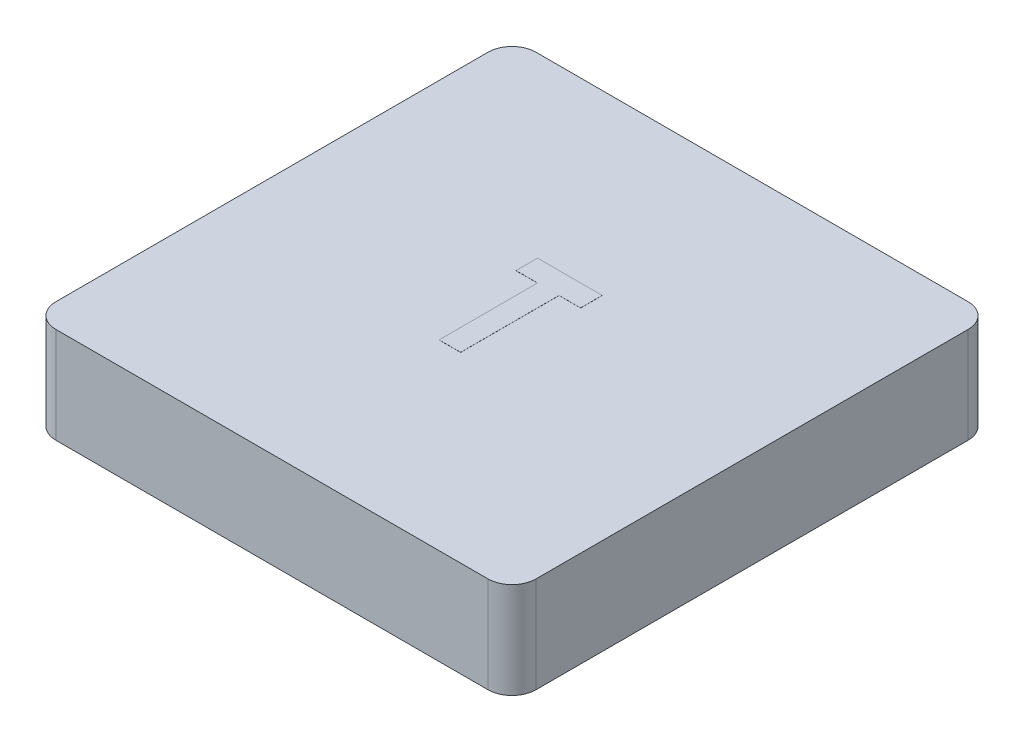
from build123d import *

# Parameters (mm, degrees)
SKETCH1_W           = 12.7
SKETCH1_H           = 12.7
BOSS_EXTRUDE1_DEPTH = 2.54
FILLET1_R           = 0.635
SHELL1_START        = 0.635
SHELL1_OUTLINE_W    = 1.905
SHELL1_OUTLINE_H    = 11.43
SHELL1_DEPTH        = 11.43
SKETCH2_R           = 2.54
BOSS_EXTRUDE2_DEPTH = 1.905
BOSS_EXTRUDE3_DEPTH = 0.00254


# Read off the part's stored shape, not the designer's step: Shell1
with BuildPart() as part:
    # Sketch1 → Boss-Extrude1 (new body)
    with BuildSketch(Plane(origin=(0, 0, 0), x_dir=(1, 0, 0), z_dir=(0, 1, 0))):
        with Locations((6.35, 6.35)):
            Rectangle(SKETCH1_W, SKETCH1_H)
    extrude(amount=BOSS_EXTRUDE1_DEPTH)

    # Fillet1
    fillet1_edges = [part.edges().sort_by_distance(p)[0] for p in [
        (0, 1.27, -12.7),
        (12.7, 1.27, -12.7),
        (12.7, 1.27, 0),
        (0, 1.27, 0),
    ]]
    fillet(fillet1_edges, radius=FILLET1_R)

    # Shell1 outline → Shell1 (cut)
    with BuildSketch(Plane.YZ.offset(SHELL1_START)):
        with Locations((0.9525, -6.35)):
            Rectangle(SHELL1_OUTLINE_W, SHELL1_OUTLINE_H)
    extrude(amount=SHELL1_DEPTH, mode=Mode.SUBTRACT)

    # Sketch2 → Boss-Extrude2 (add)
    with BuildSketch(Plane(origin=(0, 1.905, 0), x_dir=(-1, 0, 0), z_dir=(0, -1, 0))):
        with Locations(Location((-6.35, 6.35, 0), (0, 0, 270))):
            Circle(SKETCH2_R)
    extrude(amount=BOSS_EXTRUDE2_DEPTH)

    # Sketch3 → Boss-Extrude3 (add)
    with BuildSketch(Plane(origin=(0, 2.54, 0), x_dir=(1, 0, 0), z_dir=(0, 1, 0))):
        Polygon((5.374705128, 8.001), (7.084320513, 8.001), (7.084320513, 7.431128205), (6.514448718, 7.431128205), (6.514448718, 4.826), (5.944576923, 4.826), (5.944576923, 7.431128205), (5.374705128, 7.431128205), align=None)
    extrude(amount=BOSS_EXTRUDE3_DEPTH)


solid = part.part
